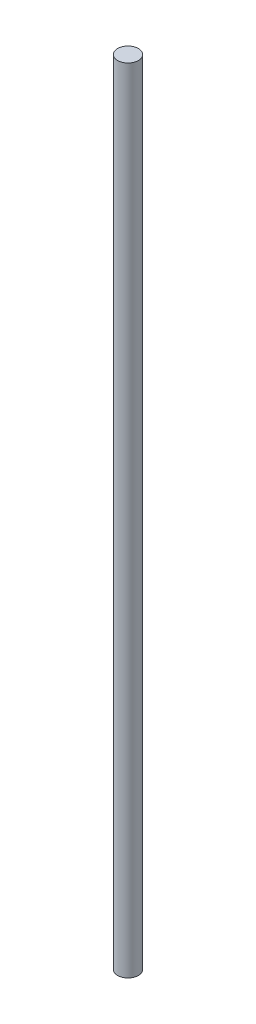
from build123d import *

# Parameters (mm, degrees)
SKETCH1_R           = 5
BOSS_EXTRUDE1_DEPTH = 380


with BuildPart() as part:
    # Sketch1 → Boss-Extrude1 (new body)
    with BuildSketch(Plane(origin=(0, 0, 0), x_dir=(1, 0, 0), z_dir=(0, 1, 0))):
        Circle(SKETCH1_R)
    extrude(amount=BOSS_EXTRUDE1_DEPTH)


solid = part.part
